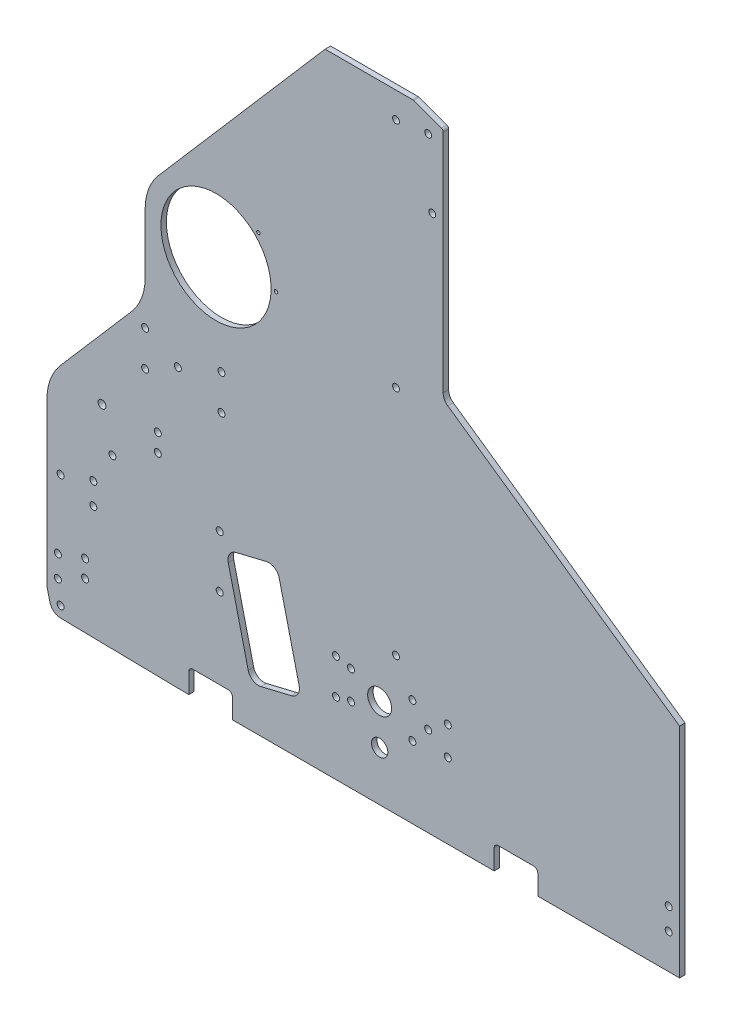
from build123d import *

# Parameters (mm, degrees)
SKETCH1_R           = 2.032
SKETCH1_R_2         = 2
BOSS_EXTRUDE1_DEPTH = 3.175
FILLET1_R           = 2.286
FILLET2_R           = 6.35
SKETCH2_R           = 2.032
CUT_EXTRUDE1_DEPTH  = 505.524983177
FILLET3_R           = 1.5875
SKETCH3_R           = 2.032
SKETCH3_R_2         = 2.286000003
SKETCH3_R_3         = 1.016
CUT_EXTRUDE2_DEPTH  = 505.524983177
SKETCH4_R           = 2.032
SKETCH4_R_2         = 6.985
SKETCH4_R_3         = 4.7625
CUT_EXTRUDE3_DEPTH  = 505.524983177
SKETCH5_R           = 32.0675
CUT_EXTRUDE5_DEPTH  = 540.282512256
FILLET4_R           = 31.75


with BuildPart() as part:
    # Sketch1 → Boss-Extrude1 (new body)
    with BuildSketch(Plane.XY):
        with BuildLine():
            Line((7.829508682, -19.049081656), (82.55, -20.32))
            Line((82.55, -20.32), (82.55, -6.35))
            Line((82.55, -6.35), (107.95, -6.35))
            Line((107.95, -6.35), (107.95, -20.32))
            Line((107.95, -20.32), (260.35, -20.32))
            Line((260.35, -20.32), (260.35, -6.35))
            Line((260.35, -6.35), (285.75, -6.35))
            Line((285.75, -6.35), (285.75, -20.32))
            Line((285.75, -20.32), (368.3, -20.32))
            Line((368.3, -20.32), (368.3, 106.68))
            Line((368.3, 106.68), (230.66375, 202.565))
            Line((230.66375, 202.565), (230.66375, 338.455))
            Line((230.66375, 338.455), (213.19998, 344.805))
            Line((213.19998, 344.805), (203.2, 344.805))
            Line((203.2, 344.805), (161.925, 344.805))
            Line((161.925, 344.805), (52.720122664, 218.469945827))
            ThreePointArc((52.720122664, 218.469945827), (52.803835479, 218.142145922), (52.832, 217.805))
            ThreePointArc((52.832, 217.805), (52.095493096, 216.239521914), (50.419872403, 215.808871996))
            Line((50.419872403, 215.808871996), (0, 157.48))
            Line((0, 157.48), (0, 0))
            Line((0, 0), (0, -6.35))
            ThreePointArc((0, -6.35), (0.047577015, -7.125863724), (0.189595124, -7.890101219))
            Line((0.189595124, -7.890101219), (1.777095124, -14.240101219))
            ThreePointArc((1.777095124, -14.240101219), (3.987212552, -17.671692778), (7.829508682, -19.049081656))
        make_face()
        with Locations((7.9375, -12.7)):
            Circle(SKETCH1_R, mode=Mode.SUBTRACT)
        with Locations((6.35, 0)):
            Circle(SKETCH1_R, mode=Mode.SUBTRACT)
        with Locations((6.35, 12.7)):
            Circle(SKETCH1_R, mode=Mode.SUBTRACT)
        with Locations((38.1, 78.105)):
            Circle(SKETCH1_R, mode=Mode.SUBTRACT)
        with Locations((57.15, 131.28625)):
            Circle(SKETCH1_R, mode=Mode.SUBTRACT)
        with Locations((57.15, 151.92375)):
            Circle(SKETCH1_R, mode=Mode.SUBTRACT)
        with Locations((76.2, 141.605)):
            Circle(SKETCH1_R, mode=Mode.SUBTRACT)
        with Locations((101.6, 131.28625)):
            Circle(SKETCH1_R, mode=Mode.SUBTRACT)
        with Locations((101.6, 151.92375)):
            Circle(SKETCH1_R, mode=Mode.SUBTRACT)
        with Locations((203.2, 59.805)):
            Circle(SKETCH1_R_2, mode=Mode.SUBTRACT)
        with Locations((361.95, 0)):
            Circle(SKETCH1_R, mode=Mode.SUBTRACT)
        with Locations((361.95, 12.7)):
            Circle(SKETCH1_R, mode=Mode.SUBTRACT)
        with Locations((76.2, 217.805)):
            Circle(SKETCH1_R, mode=Mode.SUBTRACT)
        with Locations((203.2, 194.805)):
            Circle(SKETCH1_R_2, mode=Mode.SUBTRACT)
        with Locations((224.31375, 293.243)):
            Circle(SKETCH1_R, mode=Mode.SUBTRACT)
        with Locations((203.2, 329.805)):
            Circle(SKETCH1_R_2, mode=Mode.SUBTRACT)
        with Locations((221.931865, 332.105)):
            Circle(SKETCH1_R_2, mode=Mode.SUBTRACT)
    extrude(amount=BOSS_EXTRUDE1_DEPTH)

    # Fillet1
    fillet1_edges = [part.edges().sort_by_distance(p)[0] for p in [
        (285.75, -6.35, 1.5875),
        (107.95, -6.35, 1.5875),
        (260.35, -6.35, 1.5875),
        (82.55, -6.35, 1.5875),
    ]]
    fillet(fillet1_edges, radius=FILLET1_R)

    # Fillet2
    fillet2_edges = [part.edges().sort_by_distance(p)[0] for p in [
        (230.66375, 202.565, 1.5875),
    ]]
    fillet(fillet2_edges, radius=FILLET2_R)

    # Sketch2 → Cut-Extrude1 (cut, through all)
    with BuildSketch(Plane(origin=(0, 0, 0), x_dir=(-1, 0, 0), z_dir=(0, 0, -1))):
        with Locations((-100.552770272, 71.086035298)):
            Circle(SKETCH2_R)
        with Locations((-100.552770272, 40.606035298)):
            Circle(SKETCH2_R)
        with Locations((-22.225, 18.202541089)):
            Circle(SKETCH2_R)
        with Locations((-22.225, 8.042541089)):
            Circle(SKETCH2_R)
    extrude(amount=-CUT_EXTRUDE1_DEPTH, mode=Mode.SUBTRACT)

    # Fillet3
    fillet3_edges = [part.edges().sort_by_distance(p)[0] for p in [
        (230.66375, 338.455, 1.5875),
        (213.19998, 344.805, 1.5875),
    ]]
    fillet(fillet3_edges, radius=FILLET3_R)

    # Sketch3 → Cut-Extrude2 (cut, through all)
    with BuildSketch(Plane.XY.offset(3.175)):
        with BuildLine():
            Line((127.789350204, 69.359774106), (110.090750333, 65.117184968))
            ThreePointArc((110.090750333, 65.117184968), (106.287939849, 62.356288953), (105.551195063, 57.715047577))
            Line((105.551195063, 57.715047577), (117.160037868, 9.287010566))
            ThreePointArc((117.160037868, 9.287010566), (119.920933884, 5.484200083), (124.562175259, 4.747455297))
            Line((124.562175259, 4.747455297), (142.260775131, 8.990044434))
            ThreePointArc((142.260775131, 8.990044434), (146.063585615, 11.75094045), (146.8003304, 16.392181825))
            Line((146.8003304, 16.392181825), (135.191487595, 64.820218836))
            ThreePointArc((135.191487595, 64.820218836), (132.43059158, 68.62302932), (127.789350204, 69.359774106))
        make_face()
        with Locations((26.987500002, 46.953113935)):
            Circle(SKETCH3_R)
        with Locations((26.987500002, 59.653113935)):
            Circle(SKETCH3_R)
        with Locations((7.937500002, 53.303113935)):
            Circle(SKETCH3_R)
        with Locations((32.030600734, 100.810868777)):
            Circle(SKETCH3_R_2)
        with Locations((64.525942114, 102.94048958)):
            Circle(SKETCH3_R)
        with Locations((64.525942114, 92.525786339)):
            Circle(SKETCH3_R)
        with Locations((133.35, 208.228121768)):
            Circle(SKETCH3_R_3)
        with Locations((123.120704333, 232.923826101)):
            Circle(SKETCH3_R_3)
    extrude(amount=-CUT_EXTRUDE2_DEPTH, mode=Mode.SUBTRACT)

    # Sketch4 → Cut-Extrude3 (cut, through all)
    with BuildSketch(Plane.XY.offset(3.175)):
        with Locations((168.275, 42.06875)):
            Circle(SKETCH4_R)
        with Locations((212.725, 42.06875)):
            Circle(SKETCH4_R)
        with Locations((212.725, 21.43125)):
            Circle(SKETCH4_R)
        with Locations((168.275, 21.43125)):
            Circle(SKETCH4_R)
        with Locations((193.675, 31.75)):
            Circle(SKETCH4_R_2)
        with Locations((177.00498, 40.0431)):
            Circle(SKETCH4_R)
        with Locations((177.00498, 23.4569)):
            Circle(SKETCH4_R)
        with Locations((193.675, 8.466666658)):
            Circle(SKETCH4_R_3)
        with Locations((221.931865, 31.75)):
            Circle(SKETCH4_R)
        with Locations((233.36123, 23.4569)):
            Circle(SKETCH4_R)
        with Locations((233.36123, 40.0431)):
            Circle(SKETCH4_R)
    extrude(amount=-CUT_EXTRUDE3_DEPTH, mode=Mode.SUBTRACT)

    # Sketch5 → Cut-Extrude5 (cut, through all)
    with BuildSketch(Plane(origin=(0, 0, -187.325), x_dir=(-1, 0, 0), z_dir=(0, 0, -1))):
        Polygon((0, 157.48), (-57.15, 223.594705882), (-57.15, 165.333696112), (0, 99.218990229), align=None)
        with Locations((-98.425, 208.228121768)):
            Circle(SKETCH5_R)
    extrude(amount=-CUT_EXTRUDE5_DEPTH, mode=Mode.SUBTRACT)

    # Fillet4
    fillet4_edges = [part.edges().sort_by_distance(p)[0] for p in [
        (0, 99.218990229, 1.5875),
        (57.15, 165.333696112, 1.5875),
        (57.15, 223.594705882, 1.5875),
    ]]
    fillet(fillet4_edges, radius=FILLET4_R)


solid = part.part
